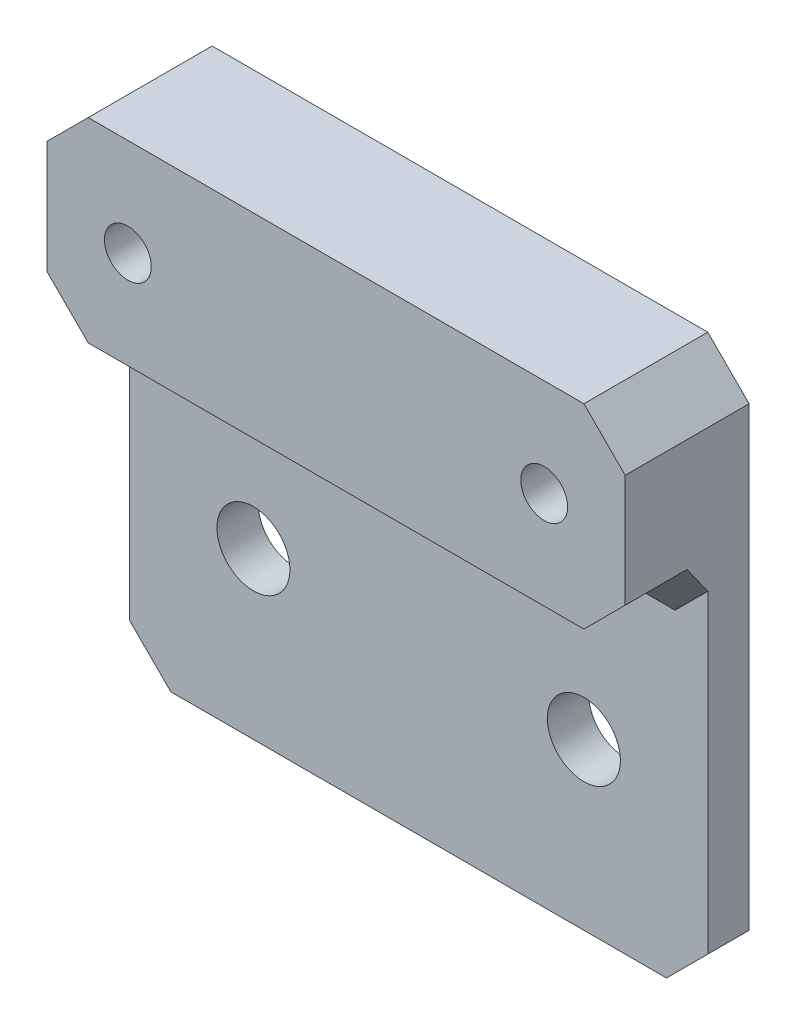
from build123d import *

# Parameters (mm, degrees)
BOSS_EXTRUDE1_DEPTH                              = 3.175
SKETCH2_W                                        = 44.45
SKETCH2_H                                        = 15
BOSS_EXTRUDE2_DEPTH                              = 6.35
CBORE_FOR_M3_HEX_HEAD_MACHINE_SCREW1_D           = 3.6
CBORE_FOR_M3_HEX_HEAD_MACHINE_SCREW1_CBORE_D     = 8.4
CBORE_FOR_M3_HEX_HEAD_MACHINE_SCREW1_CBORE_DEPTH = 2.3
CHAMFER2_SIZE                                    = 3.175
CHAMFER1_SIZE                                    = 1.5875
F_10_CLEARANCE_HOLE1_D                           = 5.6134


with BuildPart() as part:
    # Sketch1 → Boss-Extrude1 (new body)
    with BuildSketch(Plane.XY):
        Polygon((-22.225, 12.7), (-22.225, -12.7), (22.225, -12.7), (22.225, 12.7), (22.225, 13.7), (22.225, 28.7), (-22.225, 28.7), (-22.225, 13.7), align=None)
    extrude(amount=BOSS_EXTRUDE1_DEPTH)

    # Sketch2 → Boss-Extrude2 (add)
    with BuildSketch(Plane.XY.offset(3.175)):
        with Locations((0, 21.2)):
            Rectangle(SKETCH2_W, SKETCH2_H)
    extrude(amount=BOSS_EXTRUDE2_DEPTH)

    # CBORE for M3 Hex Head Machine Screw1 (through all)
    with Locations(Plane(origin=(0, 0, 0), x_dir=(-1, 0, 0), z_dir=(0, 0, -1))):
        with Locations((-16, 21.2), (16, 21.2)):
            CounterBoreHole(CBORE_FOR_M3_HEX_HEAD_MACHINE_SCREW1_D / 2, CBORE_FOR_M3_HEX_HEAD_MACHINE_SCREW1_CBORE_D / 2, CBORE_FOR_M3_HEX_HEAD_MACHINE_SCREW1_CBORE_DEPTH)

    # Chamfer2
    chamfer2_edges = [part.edges().sort_by_distance(p)[0] for p in [
        (22.225, 13.7, 6.35),
        (-22.225, 13.7, 6.35),
        (-22.225, 28.7, 4.7625),
        (22.225, 28.7, 4.7625),
        (22.225, -12.7, 1.5875),
        (-22.225, -12.7, 1.5875),
    ]]
    chamfer(chamfer2_edges, length=CHAMFER2_SIZE)

    # Chamfer1
    chamfer1_edges = [part.edges().sort_by_distance(p)[0] for p in [
        (0, 13.7, 3.175),
        (20.6375, 15.2875, 3.175),
        (-20.6375, 15.2875, 3.175),
    ]]
    chamfer(chamfer1_edges, length=CHAMFER1_SIZE)

    # #10 Clearance Hole1 (through all)
    with Locations(Plane.XY.offset(3.175)):
        with Locations((-12.7, 0), (12.7, 0)):
            Hole(F_10_CLEARANCE_HOLE1_D / 2)


solid = part.part
